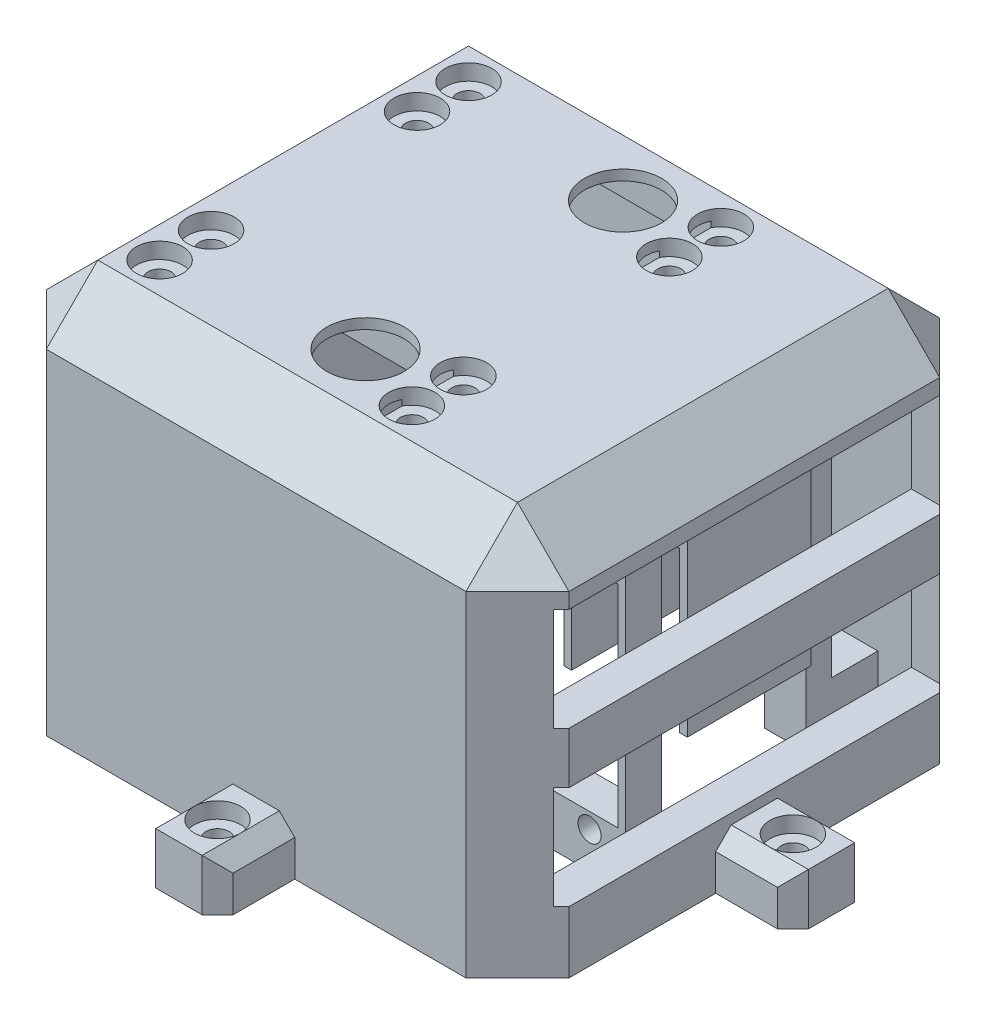
from build123d import *

# Parameters (mm, degrees)
SKETCH1_W                                = 101.5
SKETCH1_H                                = 92
BOSS_EXTRUDE1_DEPTH                      = 75
SKETCH2_W                                = 41
SKETCH2_H                                = 21
CUT_EXTRUDE1_DEPTH                       = 73
SKETCH4_W                                = 57
SKETCH4_H                                = 21
CUT_EXTRUDE3_DEPTH                       = 95.427551594
CBORE_FOR_M4_PAN_HEAD_SCREW1_D           = 4.5
CBORE_FOR_M4_PAN_HEAD_SCREW1_CBORE_D     = 9
CBORE_FOR_M4_PAN_HEAD_SCREW1_CBORE_DEPTH = 3.1
SKETCH8_R                                = 7.5
CUT_EXTRUDE4_DEPTH                       = 101.102759702
SKETCH9_W                                = 87.5
SKETCH9_H                                = 78
CUT_EXTRUDE5_DEPTH                       = 65
BOSS_EXTRUDE3_REACH                      = 103.57
SKETCH15_W                               = 8
SKETCH15_H                               = 5
M4_START                                 = -31
M4_CLEARANCE_HOLE4_OUTLINE_R             = 2.25
M4_CLEARANCE_HOLE4_DEPTH                 = 62
SKETCH18_W                               = 7
SKETCH18_H                               = 63
SKETCH18_W_2                             = 24
SKETCH18_H_2                             = 43
BOSS_EXTRUDE4_DEPTH                      = 12
CUT_EXTRUDE6_REACH                       = 112.89
SKETCH19_W                               = 21
SKETCH19_H                               = 41
M4_CLEARANCE_HOLE5_D                     = 4.5
M4_CLEARANCE_HOLE5_DEPTH                 = 7
SKETCH23_W                               = 75
SKETCH23_H                               = 20
CUT_EXTRUDE7_DEPTH                       = 7
BOSS_EXTRUDE5_REACH                      = 120.223
SKETCH25_W                               = 8
SKETCH25_H                               = 10
SKETCH26_W                               = 15
SKETCH26_H                               = 15
BOSS_EXTRUDE6_DEPTH                      = 10
CBORE_FOR_M4_PAN_HEAD_SCREW2_D           = 4.5
CBORE_FOR_M4_PAN_HEAD_SCREW2_CBORE_D     = 9
CBORE_FOR_M4_PAN_HEAD_SCREW2_CBORE_DEPTH = 3.1
CHAMFER2_SIZE                            = 3
CHAMFER2_OF_MIRROR7_SIZE                 = 3
MIRROR8_OUTLINE_R                        = 2.25
MIRROR8_DEPTH                            = 6.9
MIRROR8_START                            = 6.9
MIRROR8_2_OUTLINE_R                      = 4.5
MIRROR8_2_DEPTH                          = 0.1
MIRROR8_START_2                          = -65.75
MIRROR8_3_DEPTH                          = 15.75
MIRROR8_START_3                          = 7
MIRROR8_4_OUTLINE_R                      = 4.5
MIRROR8_4_DEPTH                          = 3


with BuildPart() as part:
    # Sketch1 → Boss-Extrude1 (new body)
    with BuildSketch(Plane(origin=(0, 0, 0), x_dir=(1, 0, 0), z_dir=(0, 1, 0))):
        Rectangle(SKETCH1_W, SKETCH1_H)
    extrude(amount=BOSS_EXTRUDE1_DEPTH)

    # Sketch2 → Cut-Extrude1 (cut)
    with BuildSketch(Plane.XZ):
        with Locations((-10.25, 25)):
            Rectangle(SKETCH2_W, SKETCH2_H)
    cut_extrude1 = extrude(amount=-CUT_EXTRUDE1_DEPTH, mode=Mode.SUBTRACT)

    # Sketch4 → Cut-Extrude3 (cut, through all)
    with BuildSketch(Plane(origin=(0, 65, 0), x_dir=(-1, 0, 0), z_dir=(0, -1, 0))):
        with Locations((10.25, -25)):
            Rectangle(SKETCH4_W, SKETCH4_H)
    cut_extrude3 = extrude(amount=CUT_EXTRUDE3_DEPTH, mode=Mode.SUBTRACT)

    # CBORE for M4 Pan Head Screw1 (through all)
    with Locations(Plane(origin=(-12.932320656, 75, 1.185529335), x_dir=(-1, 0, 0), z_dir=(0, 1, 0))):
        with Locations((21.817679344, 18.814470665), (-27.182320656, 18.814470665), (-27.182320656, 28.814470665), (21.817679344, 28.814470665)):
            cbore_for_m4_pan_head_screw1 = CounterBoreHole(CBORE_FOR_M4_PAN_HEAD_SCREW1_D / 2, CBORE_FOR_M4_PAN_HEAD_SCREW1_CBORE_D / 2, CBORE_FOR_M4_PAN_HEAD_SCREW1_CBORE_DEPTH)

    # Sketch8 → Cut-Extrude4 (cut, through all)
    with BuildSketch(Plane.XZ.offset(-73)):
        with Locations(Location((0.25, 25, 0), (0, 0, 270))):
            Circle(SKETCH8_R)
    cut_extrude4 = extrude(amount=-CUT_EXTRUDE4_DEPTH, mode=Mode.SUBTRACT)

    # Mirror1: Cut-Extrude1, Cut-Extrude3, CBORE for M4 Pan Head Screw1, Cut-Extrude4 across plane
    add(cut_extrude1.mirror(Plane.XY), mode=Mode.SUBTRACT)
    add(cut_extrude3.mirror(Plane.XY), mode=Mode.SUBTRACT)
    add(cbore_for_m4_pan_head_screw1.mirror(Plane.XY), mode=Mode.SUBTRACT)
    add(cut_extrude4.mirror(Plane.XY), mode=Mode.SUBTRACT)

    # Sketch9 → Cut-Extrude5 (cut)
    with BuildSketch(Plane.XZ):
        Rectangle(SKETCH9_W, SKETCH9_H)
    extrude(amount=-CUT_EXTRUDE5_DEPTH, mode=Mode.SUBTRACT)

    # Sketch15 → Boss-Extrude3 (add, up to next)
    with BuildSketch(Plane(origin=(0, 0, 0), x_dir=(1, 0, 0), z_dir=(0, 1, 0)), mode=Mode.PRIVATE) as boss_extrude3_sk1:
        with Locations((31.75, -27.5)):
            Rectangle(SKETCH15_W, SKETCH15_H)
    boss_extrude3_tool1 = extrude(boss_extrude3_sk1.sketch, amount=BOSS_EXTRUDE3_REACH, mode=Mode.PRIVATE) - part.part
    boss_extrude3 = boss_extrude3_tool1.solids().sort_by_distance((31.75, 0, 27.5))[0]
    add(boss_extrude3)

    # Mirror3: Boss-Extrude3 across plane
    add(boss_extrude3.mirror(Plane.XY))

    # M4 Clearance Hole4: read off the stored shape, not the designer's step
    # M4 Clearance Hole4 outline → M4 Clearance Hole4 (cut)
    with BuildSketch(Plane.XY.offset(M4_START)):
        with Locations((31.75, 22)):
            Circle(M4_CLEARANCE_HOLE4_OUTLINE_R)
        with Locations((31.75, 52)):
            Circle(M4_CLEARANCE_HOLE4_OUTLINE_R)
    extrude(amount=M4_CLEARANCE_HOLE4_DEPTH, mode=Mode.SUBTRACT)

    # Sketch18 → Boss-Extrude4 (add, symmetric)
    with BuildSketch(Plane.ZY.offset(-31.75)):
        with Locations((14.5, 33.5)):
            Rectangle(SKETCH18_W, SKETCH18_H)
        with Locations((-6, 43.5)):
            Rectangle(SKETCH18_W_2, SKETCH18_H_2)
    extrude(amount=BOSS_EXTRUDE4_DEPTH, both=True)

    # Cut-Extrude6: up to this face of the body (flat: up to its plane)
    cut_extrude6_end = Plane(part.part.faces().sort_by_distance((31.75, 43.5, -18))[0])
    # Sketch19 → Cut-Extrude6 (cut, up to the picked face)
    with BuildSketch(Plane.XY.offset(18), mode=Mode.PRIVATE) as cut_extrude6_sk1:
        with Locations((31.75, 32.5)):
            Rectangle(SKETCH19_W, SKETCH19_H)
    cut_extrude6_tool1 = split(extrude(cut_extrude6_sk1.sketch, amount=-CUT_EXTRUDE6_REACH, mode=Mode.PRIVATE), bisect_by=cut_extrude6_end, keep=Keep.BOTH, mode=Mode.PRIVATE)
    add(cut_extrude6_tool1.solids().sort_by(Axis((31.75, 32.5, 18), (0, 0, -1)))[0], mode=Mode.SUBTRACT)

    # M4 Clearance Hole5
    with Locations(Plane.XY.offset(18)):
        with Locations((26.75, 9), (36.75, 9), (26.75, 57), (36.75, 57)):
            Hole(M4_CLEARANCE_HOLE5_D / 2, depth=M4_CLEARANCE_HOLE5_DEPTH)

    # Sketch23 → Cut-Extrude7 (cut)
    with BuildSketch(Plane(origin=(50.75, 0, 0), x_dir=(0, 0, -1), z_dir=(1, 0, 0))):
        with Locations((0, 52)):
            Rectangle(SKETCH23_W, SKETCH23_H)
        with Locations((0, 22)):
            Rectangle(SKETCH23_W, SKETCH23_H)
    extrude(amount=-CUT_EXTRUDE7_DEPTH, mode=Mode.SUBTRACT)

    # Sketch25 → Boss-Extrude5 (add, up to next)
    with BuildSketch(Plane.XY.offset(30), mode=Mode.PRIVATE) as boss_extrude5_sk1:
        with Locations((31.75, 5)):
            Rectangle(SKETCH25_W, SKETCH25_H)
    boss_extrude5_tool1 = extrude(boss_extrude5_sk1.sketch, amount=BOSS_EXTRUDE5_REACH, mode=Mode.PRIVATE) - part.part
    boss_extrude5 = boss_extrude5_tool1.solids().sort_by_distance((31.75, 5, 30))[0]
    add(boss_extrude5)

    # Mirror4: Boss-Extrude5 across plane
    add(boss_extrude5.mirror(Plane.XY))

    # Chamfer1
    # the kernel refuses this chamfer: 10 mm, written as the material it takes off along each edge
    with BuildSketch(Plane(origin=(44.083333333, 68.333333333, 39.333333333), x_dir=(0, 0.7071067811865475, -0.7071067811865475), z_dir=(0.5773502691896256, 0.5773502691896256, 0.577350269189626)), Plane(origin=(44.083333333, 68.333333333, -39.333333333), x_dir=(0, -0.7071067811865475, -0.7071067811865475), z_dir=(0.5773502691896257, 0.5773502691896257, -0.5773502691896257))) as chamfer1_piece_1:
        Polygon((-7.071067812, 4.082482905), (7.071067812, 4.082482905), (0, -8.164965809), align=None)
    extrude(amount=12.701705922, mode=Mode.SUBTRACT)
    with BuildSketch(Plane(origin=(-44.083333333, 68.333333333, -39.333333333), x_dir=(0, -0.7071067811865475, -0.7071067811865475), z_dir=(-0.5773502691896256, 0.5773502691896256, -0.577350269189626)), Plane(origin=(-44.083333333, 68.333333333, 39.333333333), x_dir=(0, 0.7071067811865475, -0.7071067811865475), z_dir=(-0.5773502691896257, 0.5773502691896257, 0.5773502691896257))) as chamfer1_piece_2:
        Polygon((-7.071067812, -4.082482905), (7.071067812, -4.082482905), (0, 8.164965809), align=None)
    extrude(amount=12.701705922, mode=Mode.SUBTRACT)
    with BuildSketch(Plane(origin=(50.75, 75, 71.71682988), x_dir=(-1, 0, 0), z_dir=(0, 0, -1)), Plane(origin=(-50.75, 75, -71.71682988), x_dir=(1, 0, 0), z_dir=(0, 0, 1))) as chamfer1_piece_3:
        with BuildLine():
            Line((10.282842712, 0.282842712), (-0.282842712, -10.282842712))
            Line((-0.282842712, -10.282842712), (-0.482842712, -10.282842712))
            ThreePointArc((-0.482842712, -10.282842712), (-0.2, -5.141421356), (-0.2, 0))
            Line((-0.2, 0), (0, 0.2))
            ThreePointArc((0, 0.2), (5.141421356, 0.2), (10.282842712, 0.482842712))
            Line((10.282842712, 0.482842712), (10.282842712, 0.282842712))
        make_face()
    extrude(amount=143.433659759, mode=Mode.SUBTRACT)
    with BuildSketch(Plane(origin=(50.75, -25.71682988, -46), x_dir=(-1, 0, 0), z_dir=(0, 1, 0)), Plane(origin=(-50.75, -25.71682988, 46), x_dir=(1, 0, 0), z_dir=(0, 1, 0))) as chamfer1_piece_4:
        with BuildLine():
            Line((10.282842712, -0.282842712), (-0.282842712, 10.282842712))
            Line((-0.282842712, 10.282842712), (-0.482842712, 10.282842712))
            ThreePointArc((-0.482842712, 10.282842712), (-0.2, 5.141421356), (-0.2, 0))
            Line((-0.2, 0), (0, -0.2))
            ThreePointArc((0, -0.2), (5.141421356, -0.2), (10.282842712, -0.482842712))
            Line((10.282842712, -0.482842712), (10.282842712, -0.282842712))
        make_face()
    extrude(amount=126.433659759, mode=Mode.SUBTRACT)
    with BuildSketch(Plane(origin=(76.46682988, 75, -46), x_dir=(0, 0, 1), z_dir=(-1, 0, 0))) as chamfer1_piece_5:
        with BuildLine():
            Line((10.282842712, 0.282842712), (-0.282842712, -10.282842712))
            Line((-0.282842712, -10.282842712), (-0.482842712, -10.282842712))
            ThreePointArc((-0.482842712, -10.282842712), (-0.2, -5.141421356), (-0.2, 0))
            Line((-0.2, 0), (0, 0.2))
            ThreePointArc((0, 0.2), (5.141421356, 0.2), (10.282842712, 0.482842712))
            Line((10.282842712, 0.482842712), (10.282842712, 0.282842712))
        make_face()
    extrude(amount=152.933659759, mode=Mode.SUBTRACT)
    with BuildSketch(Plane(origin=(50.75, -25.71682988, 46), x_dir=(-1, 0, 0), z_dir=(0, 1, 0)), Plane(origin=(-50.75, -25.71682988, -46), x_dir=(1, 0, 0), z_dir=(0, 1, 0))) as chamfer1_piece_6:
        with BuildLine():
            Line((10.282842712, 0.282842712), (-0.282842712, -10.282842712))
            Line((-0.282842712, -10.282842712), (-0.482842712, -10.282842712))
            ThreePointArc((-0.482842712, -10.282842712), (-0.2, -5.141421356), (-0.2, 0))
            Line((-0.2, 0), (0, 0.2))
            ThreePointArc((0, 0.2), (5.141421356, 0.2), (10.282842712, 0.482842712))
            Line((10.282842712, 0.482842712), (10.282842712, 0.282842712))
        make_face()
    extrude(amount=126.433659759, mode=Mode.SUBTRACT)
    with BuildSketch(Plane(origin=(-76.46682988, 75, 46), x_dir=(0, -1, 0), z_dir=(1, 0, 0))) as chamfer1_piece_7:
        with BuildLine():
            Line((10.282842712, -0.282842712), (-0.282842712, 10.282842712))
            Line((-0.282842712, 10.282842712), (-0.482842712, 10.282842712))
            ThreePointArc((-0.482842712, 10.282842712), (-0.2, 5.141421356), (-0.2, 0))
            Line((-0.2, 0), (0, -0.2))
            ThreePointArc((0, -0.2), (5.141421356, -0.2), (10.282842712, -0.482842712))
            Line((10.282842712, -0.482842712), (10.282842712, -0.282842712))
        make_face()
    extrude(amount=152.933659759, mode=Mode.SUBTRACT)

    # Sketch26 → Boss-Extrude6 (add)
    with BuildSketch(Plane(origin=(0, 0, 0), x_dir=(1, 0, 0), z_dir=(0, 1, 0))):
        with Locations((0, 53.5)):
            Rectangle(SKETCH26_W, SKETCH26_H)
        with Locations((58.25, 0)):
            Rectangle(SKETCH26_W, SKETCH26_H)
    boss_extrude6 = extrude(amount=BOSS_EXTRUDE6_DEPTH)

    # CBORE for M4 Pan Head Screw2 (through all)
    with Locations(Plane(origin=(0, 10, 0), x_dir=(1, 0, 0), z_dir=(0, 1, 0))):
        with Locations((0, 53.5), (58.25, 0)):
            cbore_for_m4_pan_head_screw2 = CounterBoreHole(CBORE_FOR_M4_PAN_HEAD_SCREW2_D / 2, CBORE_FOR_M4_PAN_HEAD_SCREW2_CBORE_D / 2, CBORE_FOR_M4_PAN_HEAD_SCREW2_CBORE_DEPTH)

    # Chamfer2
    chamfer2_edges = [part.edges().sort_by_distance(p)[0] for p in [
        (58.25, 10, 7.5),
        (65.75, 5, 7.5),
        (65.75, 5, -7.5),
        (58.25, 10, -7.5),
        (-7.5, 5, -61),
        (-7.5, 10, -53.5),
        (7.5, 10, -53.5),
        (7.5, 5, -61),
    ]]
    chamfer(chamfer2_edges, length=CHAMFER2_SIZE - 0.0001)  # a hair under: the kernel refuses the full size

    # Mirror7: Boss-Extrude6, CBORE for M4 Pan Head Screw2 across plane
    add(boss_extrude6.mirror(Plane.XY))
    add(cbore_for_m4_pan_head_screw2.mirror(Plane.XY), mode=Mode.SUBTRACT)

    # Chamfer2 of Mirror7
    chamfer2_of_mirror7_edges = [part.edges().sort_by_distance(p)[0] for p in [
        (58.25, 10, -7.5),
        (65.75, 5, -7.5),
        (65.75, 5, 7.5),
        (58.25, 10, 7.5),
        (-7.5, 5, 61),
        (-7.5, 10, 53.5),
        (7.5, 10, 53.5),
        (7.5, 5, 61),
    ]]
    chamfer(chamfer2_of_mirror7_edges, length=CHAMFER2_OF_MIRROR7_SIZE - 0.0001)  # a hair under: the kernel refuses the full size

    # Mirror8: read off the stored shape, not the designer's step
    # Mirror8 outline → Mirror8 (add)
    with BuildSketch(Plane(origin=(0, 0, 0), x_dir=(1, 0, 0), z_dir=(0, 1, 0))):
        Polygon((-62.75, -7.5), (-50.75, -7.5), (-50.75, 7.5), (-62.75, 7.5), (-65.75, 4.5), (-65.75, -4.5), align=None)
        with Locations((-58.25, 0)):
            Circle(MIRROR8_OUTLINE_R, mode=Mode.SUBTRACT)
    extrude(amount=MIRROR8_DEPTH)

    # Mirror8 2 outline → Mirror8 2 (add)
    with BuildSketch(Plane(origin=(0, 0, 0), x_dir=(1, 0, 0), z_dir=(0, 1, 0)).offset(MIRROR8_START)):
        Polygon((-62.75, -7.5), (-50.75, -7.5), (-50.75, 7.5), (-62.75, 7.5), (-65.75, 4.5), (-65.75, -4.5), align=None)
        with Locations((-58.25, 0)):
            Circle(MIRROR8_2_OUTLINE_R, mode=Mode.SUBTRACT)
    extrude(amount=MIRROR8_2_DEPTH)

    # Mirror8 3 outline → Mirror8 3 (add)
    with BuildSketch(Plane.YZ.offset(MIRROR8_START_2)):
        Polygon((10, -4.5), (10, 4.5), (7, 7.5), (7, -7.5), align=None)
    extrude(amount=MIRROR8_3_DEPTH)

    # Mirror8 4 outline → Mirror8 4 (cut)
    with BuildSketch(Plane(origin=(0, 0, 0), x_dir=(1, 0, 0), z_dir=(0, 1, 0)).offset(MIRROR8_START_3)):
        with Locations((-58.25, 0)):
            Circle(MIRROR8_4_OUTLINE_R)
        Polygon((-61.25, -9), (-65.75, -4.5), (-65.75, -9), align=None)
        Polygon((-65.75, 9), (-65.75, 4.5), (-61.25, 9), align=None)
    extrude(amount=MIRROR8_4_DEPTH, mode=Mode.SUBTRACT)


solid = part.part
